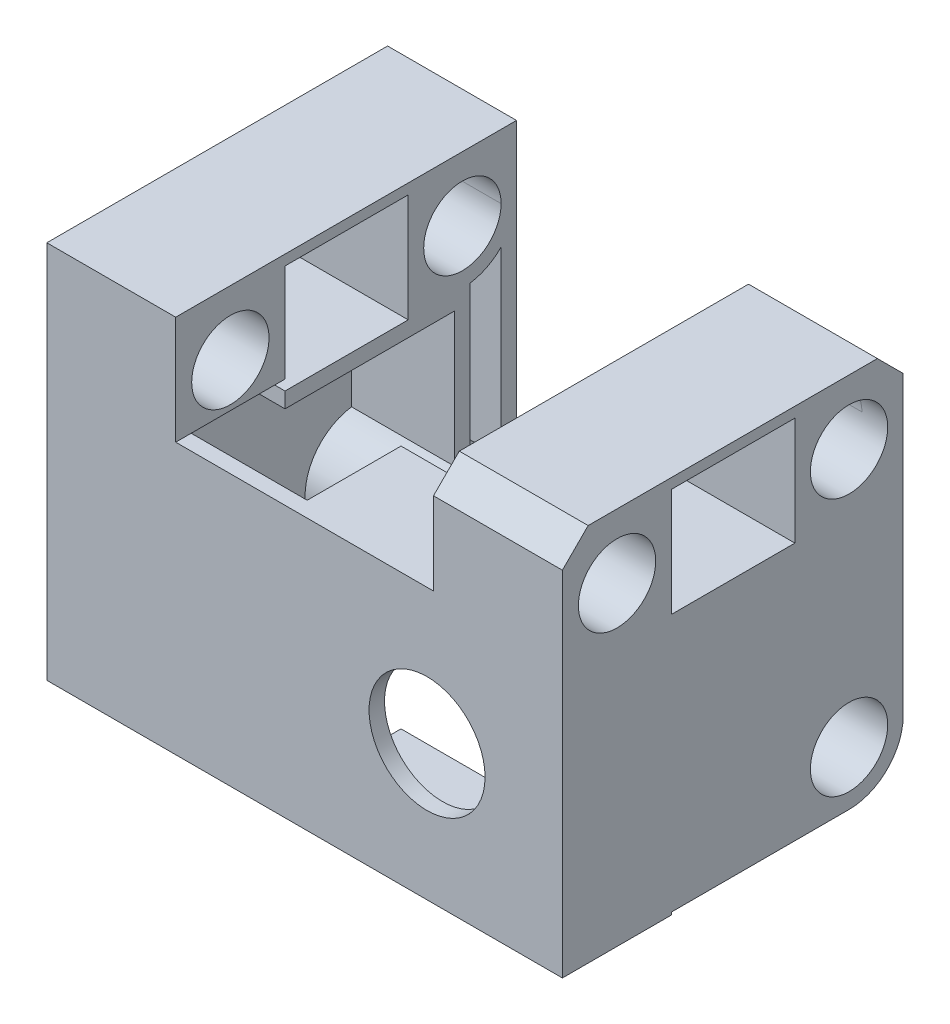
from build123d import *
from build123d.topology import SkipClean

# Parameters (mm, degrees)
SKETCH1_W               = 42.5
SKETCH1_H               = 42.5
SKETCH1_R               = 11.25
BOSS_EXTRUDE1_DEPTH     = 3
BOSS_EXTRUDE2_DEPTH     = 18.2
SKETCH3_R               = 7.499999999999999
BOSS_EXTRUDE3_DEPTH     = 5
BOSS_EXTRUDE4_OUTLINE_W = 21.2
BOSS_EXTRUDE4_OUTLINE_H = 18.999999999999996
BOSS_EXTRUDE4_OUTLINE_R = 7.5
BOSS_EXTRUDE4_DEPTH     = 20
BOSS_EXTRUDE5_DEPTH     = 2
CHAMFER2_SIZE           = 5


# Read off the part's stored shape, not the designer's step: Boss-Extrude4
with BuildPart() as part:
    # Sketch1 → Boss-Extrude1 (new body)
    # profile 1 of 2: a face of its own
    with BuildSketch(Plane.XY):
        Polygon((-73.75000000000001, 26.250000000000004), (-26.250000000000018, 26.249999999999996), (26.249999999999986, 26.249999999999996), (26.249999999999986, -26.249999999999993), (-26.250000000000018, -26.249999999999993), (-73.75000000000001, -26.250000000000007), align=None)
        Rectangle(SKETCH1_W, SKETCH1_H, mode=Mode.SUBTRACT)
    # profile 2 of 2: a face of its own
    with BuildSketch(Plane.XY):
        Rectangle(SKETCH1_W, SKETCH1_H)
        Circle(SKETCH1_R, mode=Mode.SUBTRACT)
    extrude(amount=BOSS_EXTRUDE1_DEPTH)

    # Sketch2 → Boss-Extrude2 (add)
    with BuildSketch(Plane(origin=(0, 0, 0), x_dir=(-1, 0, 0), z_dir=(0, 0, -1))):
        Polygon((21.249999999999996, 21.25), (26.249999999999957, 21.249999999999996), (26.249999999999957, 26.249999999999996), (-26.249999999999986, 26.249999999999996), (-26.249999999999986, -26.250000000000018), (26.249999999999957, -26.250000000000018), (26.249999999999957, -21.25), (21.249999999999996, -21.25), (-21.250000000000004, -21.25), (-21.250000000000004, 21.25), align=None)
    extrude(amount=BOSS_EXTRUDE2_DEPTH)

    # Sketch3 → Boss-Extrude3 (add)
    with BuildSketch(Plane(origin=(26.249999999999986, 0, 0), x_dir=(0, 0, -1), z_dir=(1, 0, 0))):
        with BuildLine():
            Line((-3, 26.249999999999996), (-2.9999999999999973, 34.349999999999994))
            Line((-2.9999999999999973, 34.349999999999994), (-3, 45.24999999999999))
            Line((-3, 45.24999999999999), (18.2, 45.24999999999999))
            Line((18.2, 45.24999999999999), (18.2, 34.74999999999999))
            Line((18.2, 34.74999999999999), (18.2, 26.249999999999996))
            Line((18.2, 26.249999999999996), (18.2, 24.249999999999993))
            Line((18.2, 24.249999999999993), (42.1, 24.249999999999993))
            Line((42.1, 24.249999999999993), (42.1, 26.249999999999996))
            Line((42.1, 26.249999999999996), (42.1, 34.74999999999999))
            Line((42.1, 34.74999999999999), (42.1, 45.25))
            Line((42.1, 45.25), (63.1, 45.25000000000001))
            Line((63.1, 45.25000000000001), (63.100000000000016, 34.75))
            Line((63.100000000000016, 34.75), (63.100000000000016, -15.250000000000005))
            ThreePointArc((63.100000000000016, -15.250000000000005), (60.02462120245875, -22.67462120245876), (52.6, -25.75000000000001))
            Line((52.6, -25.75000000000001), (-2.9999999999999933, -25.750000000000014))
            Line((-2.9999999999999933, -25.750000000000014), (-3, 26.249999999999996))
        make_face()
        with Locations((7.599999999999999, 34.74999999999999)):
            Circle(SKETCH3_R, mode=Mode.SUBTRACT)
        with Locations((52.599999999999994, 34.74999999999999)):
            Circle(SKETCH3_R, mode=Mode.SUBTRACT)
        with Locations((52.6, -15.250000000000007)):
            Circle(SKETCH3_R, mode=Mode.SUBTRACT)
    boss_extrude3 = extrude(amount=-BOSS_EXTRUDE3_DEPTH)

    # Boss-Extrude4 outline → Boss-Extrude4 (add)
    # profile 1 of 2: a face of its own
    with SkipClean():  # the faces are left unmerged after this step: merging them gives an invalid solid
        with BuildSketch(Plane.ZY.offset(-21.250000000000004)):
            with Locations((-7.6, 35.75)):
                Rectangle(BOSS_EXTRUDE4_OUTLINE_W, BOSS_EXTRUDE4_OUTLINE_H)
            with Locations((-7.6, 34.75)):
                Circle(BOSS_EXTRUDE4_OUTLINE_R, mode=Mode.SUBTRACT)
        # profile 2 of 2: a face of its own
        with BuildSketch(Plane.ZY.offset(-21.250000000000004)):
            with BuildLine():
                Line((-18.2, 21.25), (-18.2, 24.25))
                Line((-18.2, 24.25), (-42.1, 24.25))
                Line((-42.1, 24.25), (-42.1, 45.25))
                Line((-42.1, 45.25), (-63.1, 45.25))
                Line((-63.1, 45.25), (-63.1, -15.25))
                ThreePointArc((-63.1, -15.25), (-45.726136458, -23.187253933), (-51.1, -4.857695155))
                Line((-51.1, -4.857695155), (-51.1, 21.25))
                Line((-51.1, 21.25), (-18.2, 21.25))
            make_face()
            with Locations((-52.6, -15.25)):
                Circle(BOSS_EXTRUDE4_OUTLINE_R, mode=Mode.SUBTRACT)
            with BuildLine():
                ThreePointArc((-54.1, -4.857695155), (-57.350393017, -5.886038969), (-60.1, -7.901530772))
                Line((-60.1, -7.901530772), (-60.1, 27.469667785))
                ThreePointArc((-60.1, 27.469667785), (-57.350393017, 25.454175983), (-54.1, 24.425832168))
                Line((-54.1, 24.425832168), (-54.1, -4.857695155))
            make_face(mode=Mode.SUBTRACT)
            with BuildLine():
                ThreePointArc((-45.100077378, 34.784068507), (-52.6, 27.25), (-60.099922622, 34.784068507))
                ThreePointArc((-60.099922622, 34.784068507), (-52.6, 42.318137014), (-45.100077378, 34.784068507))
            make_face(mode=Mode.SUBTRACT)
        boss_extrude4 = extrude(amount=BOSS_EXTRUDE4_DEPTH)

    # Sketch5 → Boss-Extrude5 (add)
    with SkipClean():  # the faces are left unmerged after this step: merging them gives an invalid solid
        with BuildSketch(Plane(origin=(0, 45.249999999999986, 1.495e-14), x_dir=(1, 0, 0), z_dir=(0, 1, 3.3e-16))):
            Polygon((26.249999999999986, 63.100000000000016), (1.2499999999999964, 63.100000000000016), (1.2500000000000047, -2.9999999999999853), (26.249999999999986, -2.9999999999999853), align=None)
        boss_extrude5 = extrude(amount=BOSS_EXTRUDE5_DEPTH)

    # Chamfer2
    # the kernel refuses this chamfer: 5 mm, written as the material it takes off along each edge
    with BuildSketch(Plane(origin=(39.10841493982953, 47.25000000000001, -63.1), x_dir=(0, -0.9996219169112968, -0.027495876610586317), z_dir=(-1, 0, 0))) as chamfer2_piece_1:
        Polygon((CHAMFER2_SIZE * 0.999621916911, CHAMFER2_SIZE * 0.0274958766106), (-CHAMFER2_SIZE * 0.0274958766106, CHAMFER2_SIZE * 0.999621916911), (0, 0), align=None)
    extrude(amount=50.71682987965909, mode=Mode.SUBTRACT)
    with BuildSketch(Plane(origin=(-11.60841493982955, 47.24999999999998, 3.000000000000001), x_dir=(0, -0.9996219169112968, 0.02749587661058606), z_dir=(1, 0, 0))) as chamfer2_piece_2:
        Polygon((CHAMFER2_SIZE * 0.999621916911, CHAMFER2_SIZE * 0.0274958766106), (-CHAMFER2_SIZE * 0.0274958766106, CHAMFER2_SIZE * 0.999621916911), (0, 0), align=None)
    extrude(amount=50.716829879659095, mode=Mode.SUBTRACT)

    # Mirror1: Boss-Extrude3, Boss-Extrude4, Boss-Extrude5 across plane
    add(boss_extrude3.mirror(Plane.ZY.offset(23.750000000000014)))
    add(boss_extrude4.mirror(Plane.ZY.offset(23.750000000000014)))
    add(boss_extrude5.mirror(Plane.ZY.offset(23.750000000000014)))


solid = part.part
